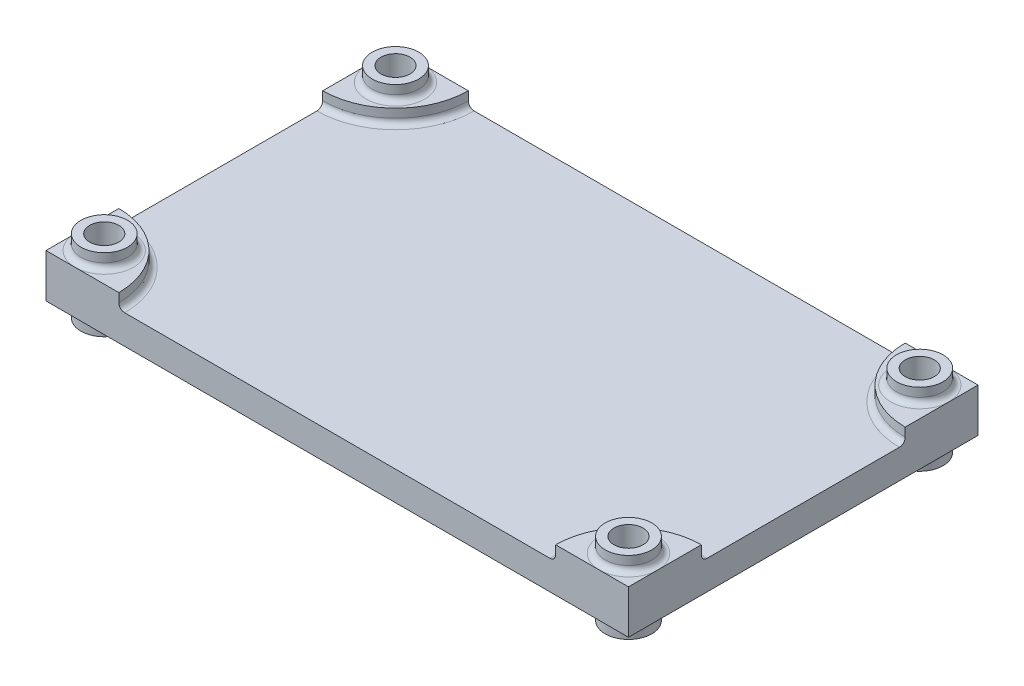
from build123d import *

# Parameters (mm, degrees)
SKETCH1_W           = 200
SKETCH1_H           = 120
BOSS_EXTRUDE3_DEPTH = 2.5
SKETCH3_R           = 5
BOSS_EXTRUDE4_DEPTH = 5
SKETCH4_R           = 8
SKETCH4_R_2         = 5
BOSS_EXTRUDE5_DEPTH = 5
FILLET1_R           = 2
FILLET2_R           = 2
BOSS_EXTRUDE6_DEPTH = 5


with BuildPart() as part:
    # Sketch1 → Boss-Extrude3 (new, symmetric)
    with BuildSketch(Plane(origin=(0, 0, 0), x_dir=(1, 0, 0), z_dir=(0, 1, 0))):
        Rectangle(SKETCH1_W, SKETCH1_H)
    extrude(amount=BOSS_EXTRUDE3_DEPTH, both=True)

    # Sketch3 → Boss-Extrude4 (add)
    # profile 1 of 4: a face of its own
    with BuildSketch(Plane(origin=(0, 2.5, 0), x_dir=(1, 0, 0), z_dir=(0, 1, 0))):
        with BuildLine():
            Line((-75, 60), (-100, 60))
            Line((-100, 60), (-100, 35))
            ThreePointArc((-100, 35), (-82.32233047, 42.32233047), (-75, 60))
        make_face()
        with Locations(Location((-90, 50, 0), (0, 0, 270))):
            Circle(SKETCH3_R, mode=Mode.SUBTRACT)
    # profile 2 of 4: a face of its own
    with BuildSketch(Plane(origin=(0, 2.5, 0), x_dir=(1, 0, 0), z_dir=(0, 1, 0))):
        with BuildLine():
            Line((100, 60), (75, 60))
            ThreePointArc((75, 60), (82.32233047, 42.32233047), (100, 35))
            Line((100, 35), (100, 60))
        make_face()
        with Locations(Location((90, 50, 0), (0, 0, 270))):
            Circle(SKETCH3_R, mode=Mode.SUBTRACT)
    # profile 3 of 4: a face of its own
    with BuildSketch(Plane(origin=(0, 2.5, 0), x_dir=(1, 0, 0), z_dir=(0, 1, 0))):
        with BuildLine():
            Line((100, -60), (100, -35))
            ThreePointArc((100, -35), (82.32233047, -42.32233047), (75, -60))
            Line((75, -60), (100, -60))
        make_face()
        with Locations(Location((90, -50, 0), (0, 0, 270))):
            Circle(SKETCH3_R, mode=Mode.SUBTRACT)
    # profile 4 of 4: a face of its own
    with BuildSketch(Plane(origin=(0, 2.5, 0), x_dir=(1, 0, 0), z_dir=(0, 1, 0))):
        with BuildLine():
            ThreePointArc((-75, -60), (-82.32233047, -42.32233047), (-100, -35))
            Line((-100, -35), (-100, -60))
            Line((-100, -60), (-75, -60))
        make_face()
        with Locations(Location((-90, -50, 0), (0, 0, 270))):
            Circle(SKETCH3_R, mode=Mode.SUBTRACT)
    boss_extrude4 = extrude(amount=BOSS_EXTRUDE4_DEPTH)

    # Sketch4 → Boss-Extrude5 (add)
    # profile 1 of 4: a face of its own
    with BuildSketch(Plane(origin=(0, 7.5, 0), x_dir=(1, 0, 0), z_dir=(0, 1, 0))):
        with Locations(Location((-90, 50, 0), (0, 0, 270))):
            Circle(SKETCH4_R)
        with Locations(Location((-90, 50, 0), (0, 0, 270))):
            Circle(SKETCH4_R_2, mode=Mode.SUBTRACT)
    # profile 2 of 4: a face of its own
    with BuildSketch(Plane(origin=(0, 7.5, 0), x_dir=(1, 0, 0), z_dir=(0, 1, 0))):
        with Locations(Location((90, 50, 0), (0, 0, 90))):
            Circle(SKETCH4_R)
        with Locations(Location((90, 50, 0), (0, 0, 270))):
            Circle(SKETCH4_R_2, mode=Mode.SUBTRACT)
    # profile 3 of 4: a face of its own
    with BuildSketch(Plane(origin=(0, 7.5, 0), x_dir=(1, 0, 0), z_dir=(0, 1, 0))):
        with Locations(Location((90, -50, 0), (0, 0, 270))):
            Circle(SKETCH4_R)
        with Locations(Location((90, -50, 0), (0, 0, 90))):
            Circle(SKETCH4_R_2, mode=Mode.SUBTRACT)
    # profile 4 of 4: a face of its own
    with BuildSketch(Plane(origin=(0, 7.5, 0), x_dir=(1, 0, 0), z_dir=(0, 1, 0))):
        with Locations(Location((-90, -50, 0), (0, 0, 90))):
            Circle(SKETCH4_R)
        with Locations(Location((-90, -50, 0), (0, 0, 90))):
            Circle(SKETCH4_R_2, mode=Mode.SUBTRACT)
    boss_extrude5 = extrude(amount=BOSS_EXTRUDE5_DEPTH)

    # Fillet1
    fillet1_edges = [part.edges().sort_by_distance(p)[0] for p in [
        (-82.32233047, 2.5, -42.32233047),
        (82.32233047, 2.5, -42.32233047),
        (82.32233047, 2.5, 42.32233047),
        (-82.32233047, 2.5, 42.32233047),
        (-90, 7.5, -58),
        (90, 7.5, -42),
        (90, 7.5, 42),
        (-90, 7.5, 58),
    ]]
    fillet(fillet1_edges, radius=FILLET1_R - 0.0001)  # a hair under: the kernel refuses the full size

    # Mirror2: Boss-Extrude4, Boss-Extrude5 across plane
    add(boss_extrude4.mirror(Plane.ZX))
    add(boss_extrude5.mirror(Plane.ZX))

    # Fillet2
    fillet2_edges = [part.edges().sort_by_distance(p)[0] for p in [
        (-90, -7.5, -58),
        (90, -7.5, -42),
        (90, -7.5, 42),
        (-90, -7.5, 58),
    ]]
    fillet(fillet2_edges, radius=FILLET2_R - 0.0001)  # a hair under: the kernel refuses the full size

    # Sketch7 → Boss-Extrude6 (add)
    with BuildSketch(Plane.XZ.offset(2.5)):
        with BuildLine():
            ThreePointArc((-98, 35.080128411), (-98.999197752, 35.020040135), (-100, 35))
            Line((-100, 35), (-100, -35))
            ThreePointArc((-100, -35), (-98.999197752, -35.020040135), (-98, -35.080128411))
            Line((-98, -35.080128411), (-98, 35.080128411))
        make_face()
        with BuildLine():
            Line((75, 60), (-75, 60))
            ThreePointArc((-75, 60), (-75.020040135, 58.999197752), (-75.080128411, 58))
            Line((-75.080128411, 58), (-75, 58))
            Line((-75, 58), (75, 58))
            Line((75, 58), (75.080128411, 58))
            ThreePointArc((75.080128411, 58), (75.020040135, 58.999197752), (75, 60))
        make_face()
        with BuildLine():
            Line((100, -35), (100, 35))
            ThreePointArc((100, 35), (98.999197752, 35.020040135), (98, 35.080128411))
            Line((98, 35.080128411), (98, -35.080128411))
            ThreePointArc((98, -35.080128411), (98.999197752, -35.020040135), (100, -35))
        make_face()
        with BuildLine():
            Line((75.080128411, -58), (-75.080128411, -58))
            ThreePointArc((-75.080128411, -58), (-75.020040135, -58.999197752), (-75, -60))
            Line((-75, -60), (75, -60))
            ThreePointArc((75, -60), (75.020040135, -58.999197752), (75.080128411, -58))
        make_face()
    extrude(amount=BOSS_EXTRUDE6_DEPTH)


solid = part.part
